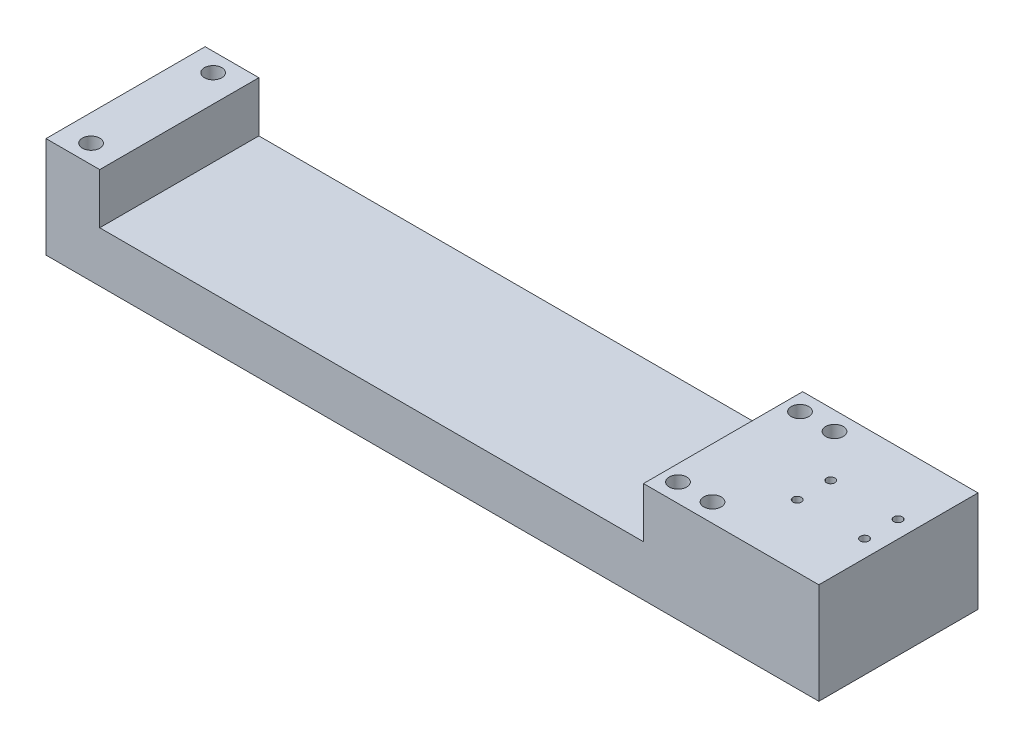
from build123d import *

# Parameters (mm, degrees)
BOSS_EXTRUDE1_DEPTH = 60
SKETCH3_R           = 3.3
CUT_EXTRUDE1_DEPTH  = 6.35
SKETCH4_R           = 1.5875
CUT_EXTRUDE2_DEPTH  = 6.35


with BuildPart() as part:
    # Sketch1 → Boss-Extrude1 (new body)
    with BuildSketch(Plane.XY):
        Polygon((-125.125, 38.05), (-104.875, 38.05), (-104.875, 19.05), (100.125, 19.05), (100.125, 38.05), (125.125, 38.05), (166.225, 38.05), (166.225, 0), (125.125, 0), (-125.125, 0), align=None)
    extrude(amount=BOSS_EXTRUDE1_DEPTH)

    # Sketch3 → Cut-Extrude1 (cut)
    with BuildSketch(Plane(origin=(0, 38.05, 0), x_dir=(1, 0, 0), z_dir=(0, 1, 0))):
        with Locations((-115.125, -53)):
            Circle(SKETCH3_R)
        with Locations((119.125, -7)):
            Circle(SKETCH3_R)
        with Locations((106.125, -7)):
            Circle(SKETCH3_R)
        with Locations((119.125, -53)):
            Circle(SKETCH3_R)
        with Locations((106.125, -53)):
            Circle(SKETCH3_R)
        with Locations((-115.125, -7)):
            Circle(SKETCH3_R)
    extrude(amount=-CUT_EXTRUDE1_DEPTH, mode=Mode.SUBTRACT)

    # Sketch4 → Cut-Extrude2 (cut)
    with BuildSketch(Plane(origin=(0, 38.05, 0), x_dir=(1, 0, 0), z_dir=(0, 1, 0))):
        with Locations((159.775, -23.675)):
            Circle(SKETCH4_R)
        with Locations((134.375, -36.325)):
            Circle(SKETCH4_R)
        with Locations((159.775, -36.325)):
            Circle(SKETCH4_R)
        with Locations((134.375, -23.675)):
            Circle(SKETCH4_R)
    extrude(amount=-CUT_EXTRUDE2_DEPTH, mode=Mode.SUBTRACT)


solid = part.part
